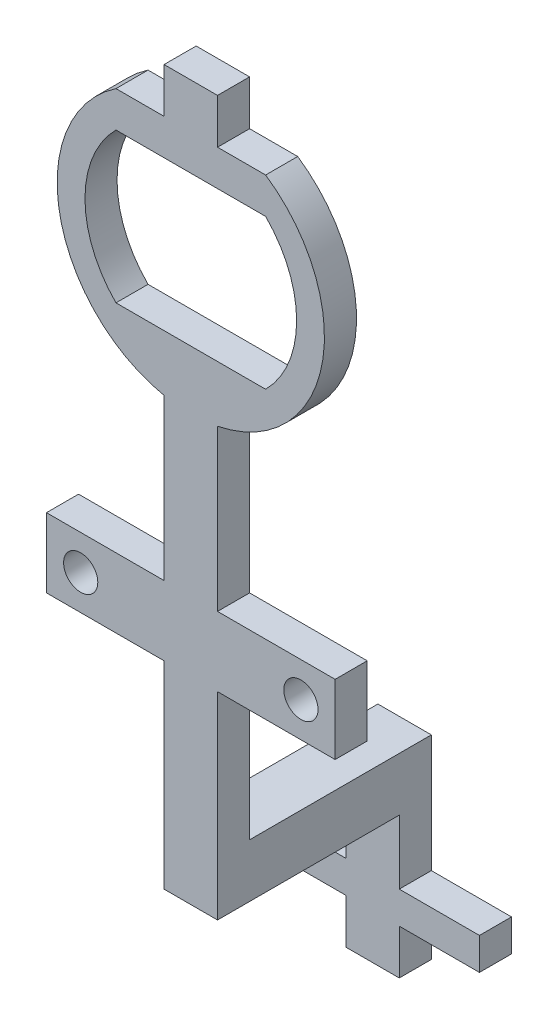
from build123d import *

# Parameters (mm, degrees)
BOSS_EXTRUDE1_DEPTH = 3
SKETCH3_W           = 27
SKETCH3_H           = 6.5
SKETCH3_R           = 1.6
BOSS_EXTRUDE4_DEPTH = 3
SKETCH4_W           = 5
SKETCH4_H           = 3
BOSS_EXTRUDE3_DEPTH = 4.2
SKETCH6_W           = 5
SKETCH6_H           = 5
BOSS_EXTRUDE5_DEPTH = 17
BOSS_EXTRUDE6_DEPTH = 3


with BuildPart() as part:
    # Sketch1 → Boss-Extrude1 (new body)
    with BuildSketch(Plane.XY):
        with BuildLine():
            Line((7, 10.356157589), (-7, 10.356157589))
            ThreePointArc((-7, 10.356157589), (-12.259414932, -2.440644491), (-2.5, -12.247448714))
            Line((-2.5, -12.247448714), (-2.5, -52.247448714))
            Line((-2.5, -52.247448714), (2.5, -52.247448714))
            Line((2.5, -52.247448714), (2.5, -12.247448714))
            ThreePointArc((2.5, -12.247448714), (12.259414932, -2.440644491), (7, 10.356157589))
        make_face()
        with BuildLine():
            ThreePointArc((-7, -7.000714249), (-9.9, 0), (-7, 7.000714249))
            Line((-7, 7.000714249), (7, 7.000714249))
            ThreePointArc((7, 7.000714249), (9.9, 0), (7, -7.000714249))
            Line((7, -7.000714249), (2.385585767, -7.000714249))
            Line((2.385585767, -7.000714249), (-2.5, -7.000714249))
            Line((-2.5, -7.000714249), (-7, -7.000714249))
        make_face(mode=Mode.SUBTRACT)
    extrude(amount=BOSS_EXTRUDE1_DEPTH)

    # Sketch3 → Boss-Extrude4 (add)
    with BuildSketch(Plane.XY):
        with Locations((0, -30.497448714)):
            Rectangle(SKETCH3_W, SKETCH3_H)
        with Locations((-10.3, -30.497448714)):
            Circle(SKETCH3_R, mode=Mode.SUBTRACT)
        with Locations((10.3, -30.497448714)):
            Circle(SKETCH3_R, mode=Mode.SUBTRACT)
    extrude(amount=BOSS_EXTRUDE4_DEPTH)

    # Sketch4 → Boss-Extrude3 (add)
    with BuildSketch(Plane(origin=(0, 10.356157589, 0), x_dir=(1, 0, 0), z_dir=(0, 1, 0))):
        with Locations((0, -1.5)):
            Rectangle(SKETCH4_W, SKETCH4_H)
    extrude(amount=BOSS_EXTRUDE3_DEPTH)

    # Sketch6 → Boss-Extrude5 (add)
    with BuildSketch(Plane(origin=(0, 0, 0), x_dir=(-1, 0, 0), z_dir=(0, 0, -1))):
        with Locations((0, -49.747448714)):
            Rectangle(SKETCH6_W, SKETCH6_H)
    extrude(amount=BOSS_EXTRUDE5_DEPTH)

    # Sketch9 → Boss-Extrude6 (add)
    with BuildSketch(Plane(origin=(0, 0, -17), x_dir=(-1, 0, 0), z_dir=(0, 0, -1))):
        Polygon((2.5, -61.243842411), (2.5, -65.443842411), (-2.5, -65.443842411), (-2.5, -61.243842411), (-10, -61.243842411), (-10, -58.243842411), (-2.5, -58.243842411), (-2.5, -52.247448714), (2.5, -52.247448714), (2.5, -58.243842411), (10, -58.243842411), (10, -61.243842411), align=None)
    extrude(amount=-BOSS_EXTRUDE6_DEPTH)


solid = part.part
